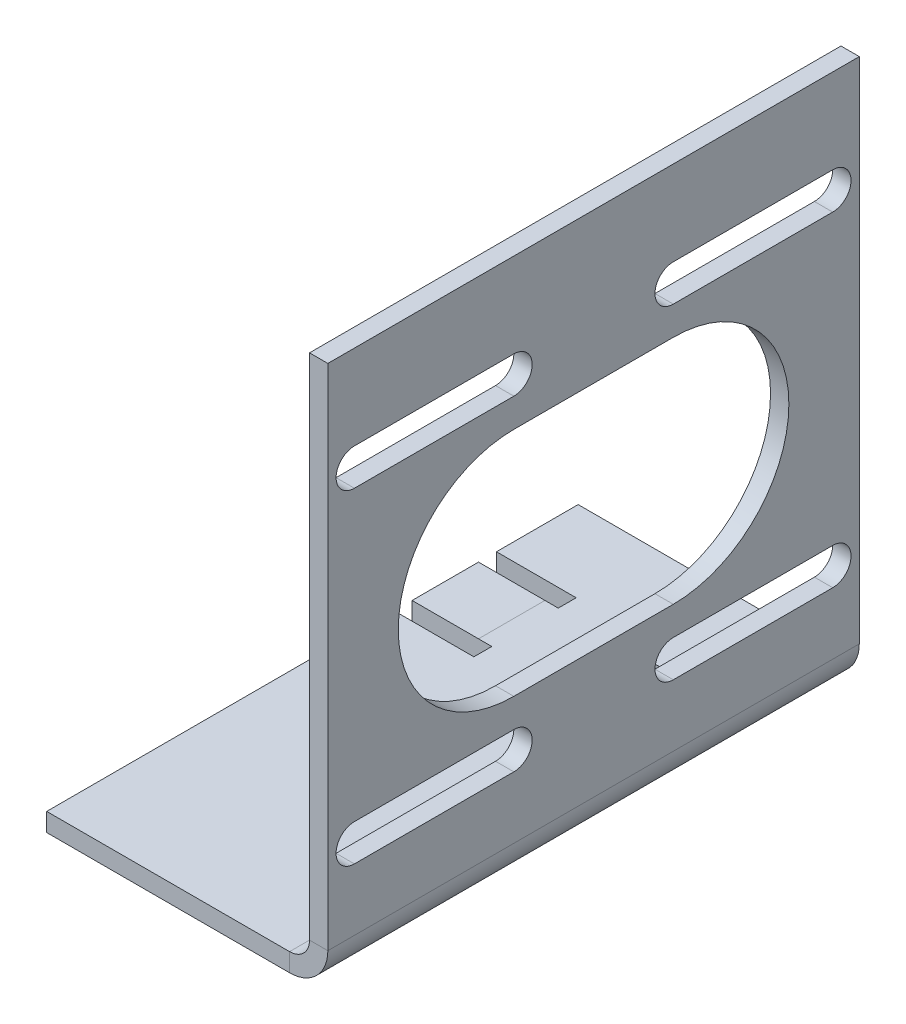
from build123d import *

# Parameters (mm, degrees)
SKETCH2_W              = 50.8
SKETCH2_H              = 76.2
BASE_FLANGE1_DEPTH     = 1.7526
SKETCHED_START         = -50.8
SKETCHED_BEND1_DEPTH   = 50.8
SKETCHED_BEND1_2_DEPTH = 50.8
CUT_EXTRUDE2_DEPTH     = 96.442377265
CUT_EXTRUDE3_REACH     = 97.512
CUT_EXTRUDE4_REACH     = 78.519
SKETCH11_R             = 3.175
CUT_EXTRUDE5_REACH     = 78.519
SKETCH12_W             = 7.62
SKETCH12_H             = 1.7145


# Read off the part's stored shape, not the designer's step: Sketched Bend1
# Sheet-metal steps are written as plain solids
with BuildPart() as part:
    # Sketch2 → Base-Flange1 (new body)
    with BuildSketch(Plane(origin=(0, 0, 0), x_dir=(0, 0, -1), z_dir=(1, 0, 0))):
        with Locations((25.4, 38.1)):
            Rectangle(SKETCH2_W, SKETCH2_H)
    extrude(amount=-BASE_FLANGE1_DEPTH)

    # Sketched Bend1 outline → Sketched Bend1 (cut)
    with BuildSketch(Plane.XY.offset(SKETCHED_START)):
        with BuildLine():
            ThreePointArc((0, 27.584427912), (-0.468104291, 25.794133277), (-1.7526, 24.462087002))
            Line((-1.7526, 24.462087002), (-1.7526, 0))
            Line((-1.7526, 0), (0, 0))
            Line((0, 0), (0, 27.584427912))
        make_face()
    extrude(amount=SKETCHED_BEND1_DEPTH, mode=Mode.SUBTRACT)

    # Sketched Bend1 2 outline → Sketched Bend1 2 (add)
    with BuildSketch(Plane.XY.offset(SKETCHED_START)):
        with BuildLine():
            ThreePointArc((-1.7526, 27.584427912), (-2.310561582, 26.237389494), (-3.6576, 25.679427912))
            Line((-3.6576, 25.679427912), (-26.873172088, 25.679427912))
            Line((-26.873172088, 25.679427912), (-26.873172088, 23.926827912))
            Line((-26.873172088, 23.926827912), (-3.6576, 23.926827912))
            ThreePointArc((-3.6576, 23.926827912), (-2.668215432, 24.063184391), (-1.7526, 24.462087002))
            Line((-1.7526, 24.462087002), (-1.7526, 27.584427912))
        make_face()
    extrude(amount=SKETCHED_BEND1_2_DEPTH)

    # Sketch9 → Cut-Extrude2 (cut, through all)
    with BuildSketch(Plane(origin=(0, 0, 0), x_dir=(0, 0, -1), z_dir=(1, 0, 0))):
        with BuildLine():
            Line((33.02, 39.751), (17.78, 39.751))
            ThreePointArc((17.78, 39.751), (6.731, 50.8), (17.78, 61.849))
            Line((17.78, 61.849), (33.02, 61.849))
            ThreePointArc((33.02, 61.849), (44.069, 50.8), (33.02, 39.751))
        make_face()
    extrude(amount=-CUT_EXTRUDE2_DEPTH, mode=Mode.SUBTRACT)

    # Sketch10 → Cut-Extrude3 (cut, up to next)
    with BuildSketch(Plane(origin=(0.2474, 0, 0), x_dir=(0, 0, -1), z_dir=(1, 0, 0)), mode=Mode.PRIVATE) as cut_extrude3_sk1:
        with BuildLine():
            Line((2.54, 68.099), (17.78, 68.099))
            ThreePointArc((17.78, 68.099), (19.53, 66.349), (17.78, 64.599))
            Line((17.78, 64.599), (2.54, 64.599))
            ThreePointArc((2.54, 64.599), (0.79, 66.349), (2.54, 68.099))
        make_face()
    cut_extrude3_tool1 = extrude(cut_extrude3_sk1.sketch, amount=-CUT_EXTRUDE3_REACH, mode=Mode.PRIVATE) & part.part
    # Sketch10 → Cut-Extrude3 (cut, up to next)
    with BuildSketch(Plane(origin=(0.2474, 0, 0), x_dir=(0, 0, -1), z_dir=(1, 0, 0)), mode=Mode.PRIVATE) as cut_extrude3_sk2:
        with BuildLine():
            Line((2.54, 33.501), (17.78, 33.501))
            ThreePointArc((17.78, 33.501), (19.53, 35.251), (17.78, 37.001))
            Line((17.78, 37.001), (2.54, 37.001))
            ThreePointArc((2.54, 37.001), (0.79, 35.251), (2.54, 33.501))
        make_face()
    cut_extrude3_tool2 = extrude(cut_extrude3_sk2.sketch, amount=-CUT_EXTRUDE3_REACH, mode=Mode.PRIVATE) & part.part
    # Sketch10 → Cut-Extrude3 (cut, up to next)
    with BuildSketch(Plane(origin=(0.2474, 0, 0), x_dir=(0, 0, -1), z_dir=(1, 0, 0)), mode=Mode.PRIVATE) as cut_extrude3_sk3:
        with BuildLine():
            Line((48.26, 33.501), (33.02, 33.501))
            ThreePointArc((33.02, 33.501), (31.27, 35.251), (33.02, 37.001))
            Line((33.02, 37.001), (48.26, 37.001))
            ThreePointArc((48.26, 37.001), (50.01, 35.251), (48.26, 33.501))
        make_face()
    cut_extrude3_tool3 = extrude(cut_extrude3_sk3.sketch, amount=-CUT_EXTRUDE3_REACH, mode=Mode.PRIVATE) & part.part
    # Sketch10 → Cut-Extrude3 (cut, up to next)
    with BuildSketch(Plane(origin=(0.2474, 0, 0), x_dir=(0, 0, -1), z_dir=(1, 0, 0)), mode=Mode.PRIVATE) as cut_extrude3_sk4:
        with BuildLine():
            Line((48.26, 68.099), (33.02, 68.099))
            ThreePointArc((33.02, 68.099), (31.27, 66.349), (33.02, 64.599))
            Line((33.02, 64.599), (48.26, 64.599))
            ThreePointArc((48.26, 64.599), (50.01, 66.349), (48.26, 68.099))
        make_face()
    cut_extrude3_tool4 = extrude(cut_extrude3_sk4.sketch, amount=-CUT_EXTRUDE3_REACH, mode=Mode.PRIVATE) & part.part
    add(cut_extrude3_tool1.solids().sort_by_distance((0.2474, 66.349, -10.16))[0], mode=Mode.SUBTRACT)
    add(cut_extrude3_tool2.solids().sort_by_distance((0.2474, 35.251, -10.16))[0], mode=Mode.SUBTRACT)
    add(cut_extrude3_tool3.solids().sort_by_distance((0.2474, 35.251, -40.64))[0], mode=Mode.SUBTRACT)
    add(cut_extrude3_tool4.solids().sort_by_distance((0.2474, 66.349, -40.64))[0], mode=Mode.SUBTRACT)

    # Sketch11 → Cut-Extrude4 (cut, up to next)
    with BuildSketch(Plane(origin=(0, 25.679427912, 0), x_dir=(1, 0, 0), z_dir=(0, 1, 0)), mode=Mode.PRIVATE) as cut_extrude4_sk1:
        with Locations(Location((-9.728172088, 38.1, 0), (0, 0, 180))):
            Circle(SKETCH11_R)
    cut_extrude4_tool1 = extrude(cut_extrude4_sk1.sketch, amount=-CUT_EXTRUDE4_REACH, mode=Mode.PRIVATE) & part.part
    add(cut_extrude4_tool1.solids().sort_by_distance((-9.728172, 25.679428, -38.1))[0], mode=Mode.SUBTRACT)

    # Sketch12 → Cut-Extrude5 (cut, up to next)
    with BuildSketch(Plane(origin=(0, 25.679427912, 0), x_dir=(1, 0, 0), z_dir=(0, 1, 0)), mode=Mode.PRIVATE) as cut_extrude5_sk1:
        with Locations((-23.063172088, 34.06775)):
            Rectangle(SKETCH12_W, SKETCH12_H)
    cut_extrude5_tool1 = extrude(cut_extrude5_sk1.sketch, amount=-CUT_EXTRUDE5_REACH, mode=Mode.PRIVATE) & part.part
    # Sketch12 → Cut-Extrude5 (cut, up to next)
    with BuildSketch(Plane(origin=(0, 25.679427912, 0), x_dir=(1, 0, 0), z_dir=(0, 1, 0)), mode=Mode.PRIVATE) as cut_extrude5_sk2:
        with Locations((-23.063172088, 42.13225)):
            Rectangle(SKETCH12_W, SKETCH12_H)
    cut_extrude5_tool2 = extrude(cut_extrude5_sk2.sketch, amount=-CUT_EXTRUDE5_REACH, mode=Mode.PRIVATE) & part.part
    add(cut_extrude5_tool1.solids().sort_by_distance((-23.063172, 25.679428, -34.06775))[0], mode=Mode.SUBTRACT)
    add(cut_extrude5_tool2.solids().sort_by_distance((-23.063172, 25.679428, -42.13225))[0], mode=Mode.SUBTRACT)


solid = part.part
